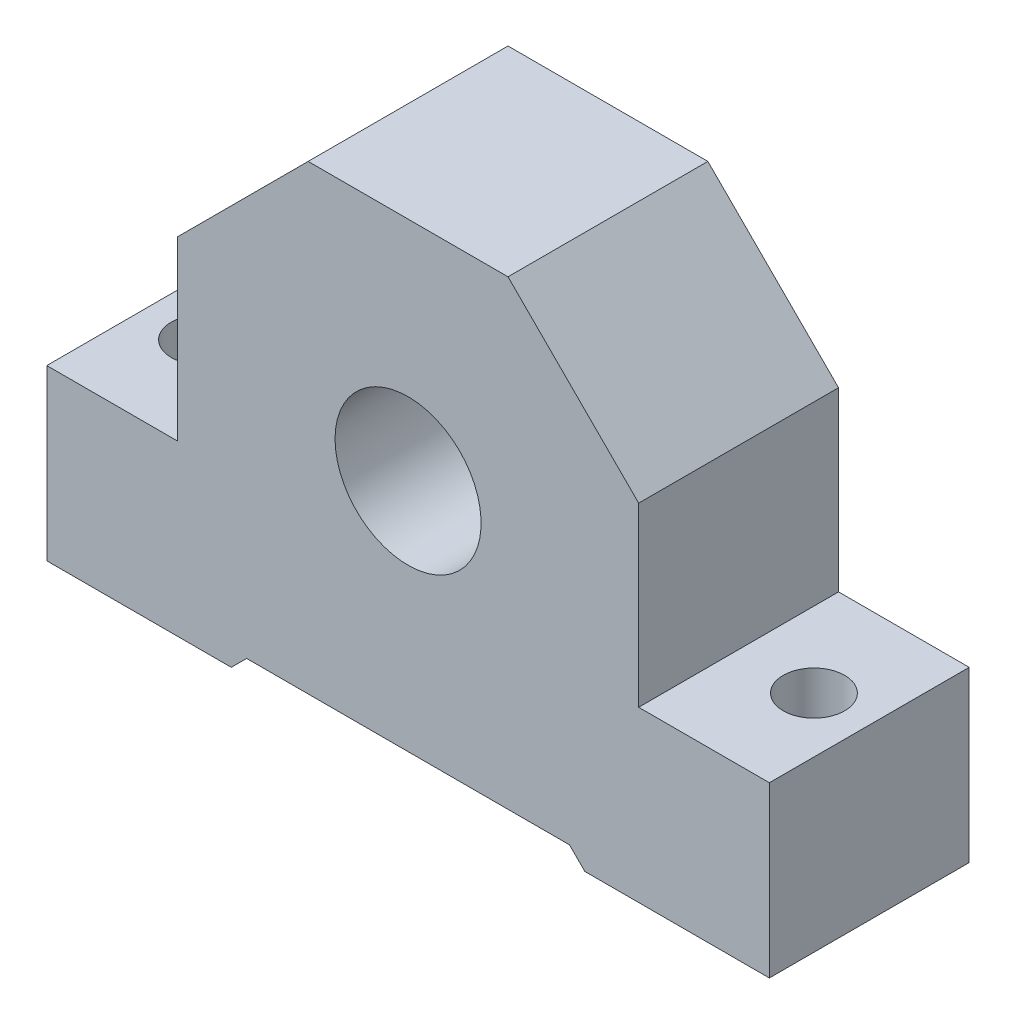
from build123d import *

# Parameters (mm, degrees)
DODANIE_WYCI_GNI_CIE1_DEPTH = 26
SZKIC3_R                    = 9.5
WYTNIJ_WYCI_GNI_CIE1_DEPTH  = 26
SZKIC4_R                    = 4
WYTNIJ_WYCI_GNI_CIE2_DEPTH  = 22


with BuildPart() as part:
    # Szkic1 → Dodanie-wyciągnięcie1 (new body)
    with BuildSketch(Plane.XY):
        Polygon((-47, 11), (-30, 11), (-30, 34), (-13, 51), (13, 51), (30, 34), (30, 11), (47, 11), (47, -11), (23, -11), (21, -9), (-21, -9), (-23, -11), (-47, -11), align=None)
    extrude(amount=DODANIE_WYCI_GNI_CIE1_DEPTH)

    # Szkic3 → Wytnij-wyciągnięcie1 (cut)
    with BuildSketch(Plane(origin=(0, 0, 0), x_dir=(-1, 0, 0), z_dir=(0, 0, -1))):
        with Locations((0, 21.5)):
            Circle(SZKIC3_R)
    extrude(amount=-WYTNIJ_WYCI_GNI_CIE1_DEPTH, mode=Mode.SUBTRACT)

    # Szkic4 → Wytnij-wyciągnięcie2 (cut)
    with BuildSketch(Plane(origin=(0, 11, 0), x_dir=(1, 0, 0), z_dir=(0, 1, 0))):
        with Locations((39.8, -13)):
            Circle(SZKIC4_R)
        with Locations((-39.8, -13)):
            Circle(SZKIC4_R)
    extrude(amount=-WYTNIJ_WYCI_GNI_CIE2_DEPTH, mode=Mode.SUBTRACT)


solid = part.part
